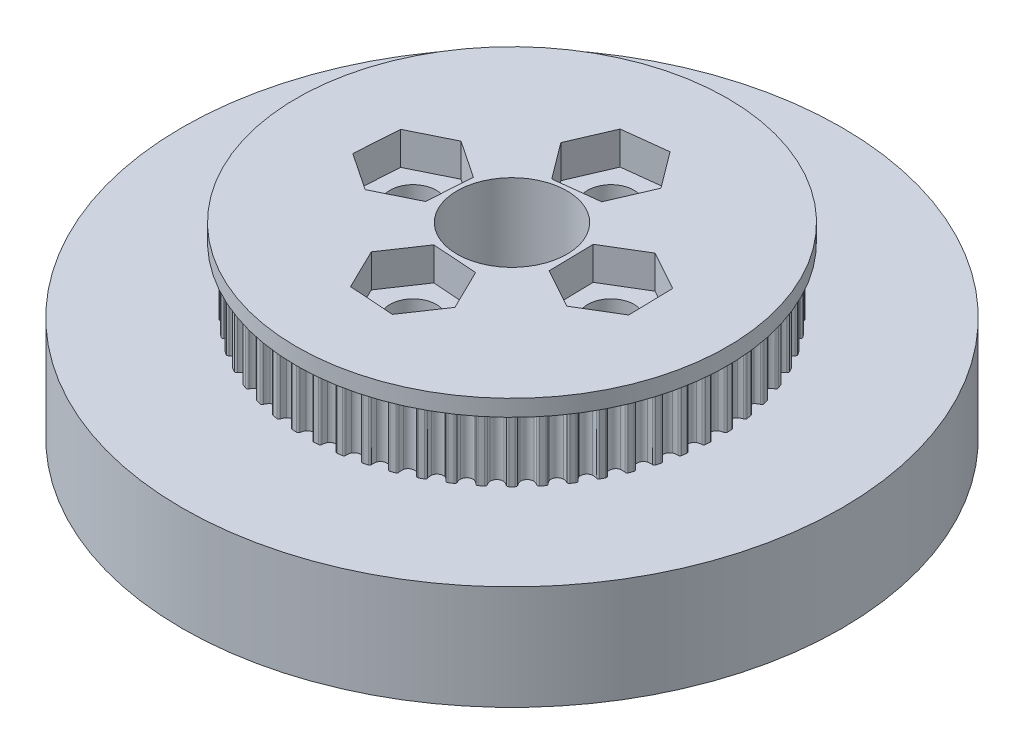
from build123d import *

# Parameters (mm, degrees)
SKETCH1_R                = 18.844609303
BOSS_EXTRUDE1_DEPTH      = 6
CUT_EXTRUDE1_START       = -10
CUT_EXTRUDE1_DEPTH       = 10
FILLET1_R                = 0.17
CIRPATTERN2_COUNT        = 60
FILLET1_OF_CIRPATTERN2_R = 0.17
SKETCH3_R                = 19.594609303
BOSS_EXTRUDE2_DEPTH      = 1.5
SKETCH4_R                = 30
BOSS_EXTRUDE3_DEPTH      = 9.5
SKETCH5_R                = 24.5
CUT_EXTRUDE2_DEPTH       = 4
SKETCH6_R                = 17
BOSS_EXTRUDE4_DEPTH      = 2
SKETCH7_R                = 12.25
BOSS_EXTRUDE5_DEPTH      = 13
SKETCH8_R                = 2.1
CUT_EXTRUDE3_DEPTH       = 51.833060227
CUT_EXTRUDE4_DEPTH       = 3
CUT_EXTRUDE5_REACH       = 52.833
SKETCH10_R               = 5


with BuildPart() as part:
    # Sketch1 → Boss-Extrude1 (new body)
    with BuildSketch(Plane(origin=(0, 0, 0), x_dir=(1, 0, 0), z_dir=(0, 1, 0))):
        Circle(SKETCH1_R)
    extrude(amount=BOSS_EXTRUDE1_DEPTH)

    # Sketch2 → Cut-Extrude1 (cut)
    with BuildSketch(Plane(origin=(0, 6, 0), x_dir=(1, 0, 0), z_dir=(0, 1, 0)).offset(CUT_EXTRUDE1_START)):
        with BuildLine():
            ThreePointArc((0.453553699, 18.286177496), (0.576034086, 18.548370442), (0.619948996, 18.834409017))
            ThreePointArc((0.619948996, 18.834409017), (0, 18.844609303), (-0.619948996, 18.834409017))
            ThreePointArc((-0.619948996, 18.834409017), (-0.576034086, 18.548370442), (-0.453553699, 18.286177496))
            ThreePointArc((-0.453553699, 18.286177496), (0, 18.064609303), (0.453553699, 18.286177496))
        make_face()
    cut_extrude1 = extrude(amount=CUT_EXTRUDE1_DEPTH, mode=Mode.SUBTRACT)

    # Fillet1
    fillet1_edges = [part.edges().sort_by_distance(p)[0] for p in [
        (0.619948996, 3, -18.834409017),
        (-0.619948996, 3, -18.834409017),
    ]]
    fillet(fillet1_edges, radius=FILLET1_R)

    # CirPattern2: Cut-Extrude1 ×60 about axis
    cirpattern2_axis = Axis((0, 6, 0), (0, -1, 0))
    for i in range(1, CIRPATTERN2_COUNT):
        add(cut_extrude1.rotate(cirpattern2_axis, i * 360 / CIRPATTERN2_COUNT), mode=Mode.SUBTRACT)

    # Fillet1 of CirPattern2
    fillet1_of_cirpattern2_edges = [part.edges().sort_by_distance(p)[0] for p in [
        (2.585284682, 3, -18.666429838),
        (1.352178981, 3, -18.79603447),
        (4.522295447, 3, -18.293937347),
        (3.309492201, 3, -18.551726635),
        (6.409758998, 3, -17.721012651),
        (5.230545933, 3, -18.104162202),
        (8.226995887, 3, -16.953932831),
        (7.094292709, 3, -17.458244778),
        (9.954096088, 3, -16.001102176),
        (8.880312929, 3, -16.621051172),
        (11.572137129, 3, -14.872960097),
        (10.569038583, 3, -15.601753851),
        (13.063391414, 3, -13.581866754),
        (12.141967638, 3, -14.411520449),
        (14.411520449, 3, -12.141967638),
        (13.581866754, 3, -13.063391414),
        (15.601753851, 3, -10.569038583),
        (14.872960097, 3, -11.572137129),
        (16.621051172, 3, -8.880312929),
        (16.001102176, 3, -9.954096088),
        (17.458244778, 3, -7.094292709),
        (16.953932831, 3, -8.226995887),
        (18.104162202, 3, -5.230545933),
        (17.721012651, 3, -6.409758998),
        (18.551726635, 3, -3.309492201),
        (18.293937347, 3, -4.522295447),
        (18.79603447, 3, -1.352178981),
        (18.666429838, 3, -2.585284682),
        (18.834409017, 3, 0.619948996),
        (18.834409017, 3, -0.619948996),
        (18.666429838, 3, 2.585284682),
        (18.79603447, 3, 1.352178981),
        (18.293937347, 3, 4.522295447),
        (18.551726635, 3, 3.309492201),
        (17.721012651, 3, 6.409758998),
        (18.104162202, 3, 5.230545933),
        (16.953932831, 3, 8.226995887),
        (17.458244778, 3, 7.094292709),
        (16.001102176, 3, 9.954096088),
        (16.621051172, 3, 8.880312929),
        (14.872960097, 3, 11.572137129),
        (15.601753851, 3, 10.569038583),
        (13.581866754, 3, 13.063391414),
        (14.411520449, 3, 12.141967638),
        (12.141967638, 3, 14.411520449),
        (13.063391414, 3, 13.581866754),
        (10.569038583, 3, 15.601753851),
        (11.572137129, 3, 14.872960097),
        (8.880312929, 3, 16.621051172),
        (9.954096088, 3, 16.001102176),
        (7.094292709, 3, 17.458244778),
        (8.226995887, 3, 16.953932831),
        (5.230545933, 3, 18.104162202),
        (6.409758998, 3, 17.721012651),
        (3.309492201, 3, 18.551726635),
        (4.522295447, 3, 18.293937347),
        (1.352178981, 3, 18.79603447),
        (2.585284682, 3, 18.666429838),
        (-0.619948996, 3, 18.834409017),
        (0.619948996, 3, 18.834409017),
        (-2.585284682, 3, 18.666429838),
        (-1.352178981, 3, 18.79603447),
        (-4.522295447, 3, 18.293937347),
        (-3.309492201, 3, 18.551726635),
        (-6.409758998, 3, 17.721012651),
        (-5.230545933, 3, 18.104162202),
        (-8.226995887, 3, 16.953932831),
        (-7.094292709, 3, 17.458244778),
        (-9.954096088, 3, 16.001102176),
        (-8.880312929, 3, 16.621051172),
        (-11.572137129, 3, 14.872960097),
        (-10.569038583, 3, 15.601753851),
        (-13.063391414, 3, 13.581866754),
        (-12.141967638, 3, 14.411520449),
        (-14.411520449, 3, 12.141967638),
        (-13.581866754, 3, 13.063391414),
        (-15.601753851, 3, 10.569038583),
        (-14.872960097, 3, 11.572137129),
        (-16.621051172, 3, 8.880312929),
        (-16.001102176, 3, 9.954096088),
        (-17.458244778, 3, 7.094292709),
        (-16.953932831, 3, 8.226995887),
        (-18.104162202, 3, 5.230545933),
        (-17.721012651, 3, 6.409758998),
        (-18.551726635, 3, 3.309492201),
        (-18.293937347, 3, 4.522295447),
        (-18.79603447, 3, 1.352178981),
        (-18.666429838, 3, 2.585284682),
        (-18.834409017, 3, -0.619948996),
        (-18.834409017, 3, 0.619948996),
        (-18.666429838, 3, -2.585284682),
        (-18.79603447, 3, -1.352178981),
        (-18.293937347, 3, -4.522295447),
        (-18.551726635, 3, -3.309492201),
        (-17.721012651, 3, -6.409758998),
        (-18.104162202, 3, -5.230545933),
        (-16.953932831, 3, -8.226995887),
        (-17.458244778, 3, -7.094292709),
        (-16.001102176, 3, -9.954096088),
        (-16.621051172, 3, -8.880312929),
        (-14.872960097, 3, -11.572137129),
        (-15.601753851, 3, -10.569038583),
        (-13.581866754, 3, -13.063391414),
        (-14.411520449, 3, -12.141967638),
        (-12.141967638, 3, -14.411520449),
        (-13.063391414, 3, -13.581866754),
        (-10.569038583, 3, -15.601753851),
        (-11.572137129, 3, -14.872960097),
        (-8.880312929, 3, -16.621051172),
        (-9.954096088, 3, -16.001102176),
        (-7.094292709, 3, -17.458244778),
        (-8.226995887, 3, -16.953932831),
        (-5.230545933, 3, -18.104162202),
        (-6.409758998, 3, -17.721012651),
        (-3.309492201, 3, -18.551726635),
        (-4.522295447, 3, -18.293937347),
        (-1.352178981, 3, -18.79603447),
        (-2.585284682, 3, -18.666429838),
    ]]
    fillet(fillet1_of_cirpattern2_edges, radius=FILLET1_OF_CIRPATTERN2_R)

    # Sketch3 → Boss-Extrude2 (add)
    with BuildSketch(Plane(origin=(0, 6, 0), x_dir=(1, 0, 0), z_dir=(0, 1, 0))):
        Circle(SKETCH3_R)
    extrude(amount=BOSS_EXTRUDE2_DEPTH)

    # Sketch4 → Boss-Extrude3 (add)
    with BuildSketch(Plane.XZ):
        Circle(SKETCH4_R)
    extrude(amount=BOSS_EXTRUDE3_DEPTH)

    # Sketch5 → Cut-Extrude2 (cut)
    with BuildSketch(Plane.XZ.offset(9.5)):
        Circle(SKETCH5_R)
    extrude(amount=-CUT_EXTRUDE2_DEPTH, mode=Mode.SUBTRACT)

    # Sketch6 → Boss-Extrude4 (add)
    with BuildSketch(Plane.XZ.offset(5.5)):
        Circle(SKETCH6_R)
    extrude(amount=BOSS_EXTRUDE4_DEPTH)

    # Sketch7 → Boss-Extrude5 (add)
    with BuildSketch(Plane.XZ.offset(7.5)):
        Circle(SKETCH7_R)
    extrude(amount=BOSS_EXTRUDE5_DEPTH)

    # Sketch8 → Cut-Extrude3 (cut, through all)
    with BuildSketch(Plane.XZ.offset(20.5)):
        with Locations((0, 9)):
            Circle(SKETCH8_R)
        with Locations((9, 0)):
            Circle(SKETCH8_R)
        with Locations((0, -9)):
            Circle(SKETCH8_R)
        with Locations((-9, 0)):
            Circle(SKETCH8_R)
    extrude(amount=-CUT_EXTRUDE3_DEPTH, mode=Mode.SUBTRACT)

    # Sketch9 → Cut-Extrude4 (cut)
    with BuildSketch(Plane(origin=(0, 7.5, 0), x_dir=(1, 0, 0), z_dir=(0, 1, 0))):
        Polygon((5.410155792, 1.978977487), (5.491233118, -2.119407536), (9.081077326, -4.098385023), (12.589844208, -1.978977487), (12.508766882, 2.119407536), (8.918922674, 4.098385023), align=None)
        Polygon((-4.071128901, 8.521206932), (-1.62091749, 5.234902415), (2.450211411, 5.713695484), (4.071128901, 9.478793068), (1.62091749, 12.765097585), (-2.450211411, 12.286304516), align=None)
        Polygon((-5.323141479, 1.812193354), (-8.730976221, 4.090349562), (-12.407834741, 2.278156208), (-12.676858521, -1.812193354), (-9.269023779, -4.090349562), (-5.592165259, -2.278156208), align=None)
        Polygon((-1.797900308, -5.316131406), (-4.08927394, -8.715093043), (-2.291373633, -12.398961637), (1.797900308, -12.683868594), (4.08927394, -9.284906957), (2.291373633, -5.601038363), align=None)
    extrude(amount=-CUT_EXTRUDE4_DEPTH, mode=Mode.SUBTRACT)

    # Sketch10 → Cut-Extrude5 (cut, up to next)
    with BuildSketch(Plane(origin=(0, 7.5, 0), x_dir=(1, 0, 0), z_dir=(0, 1, 0)), mode=Mode.PRIVATE) as cut_extrude5_sk1:
        Circle(SKETCH10_R)
    cut_extrude5_tool1 = extrude(cut_extrude5_sk1.sketch, amount=-CUT_EXTRUDE5_REACH, mode=Mode.PRIVATE) & part.part
    add(cut_extrude5_tool1.solids().sort_by_distance((0, 7.5, 0))[0], mode=Mode.SUBTRACT)


solid = part.part
